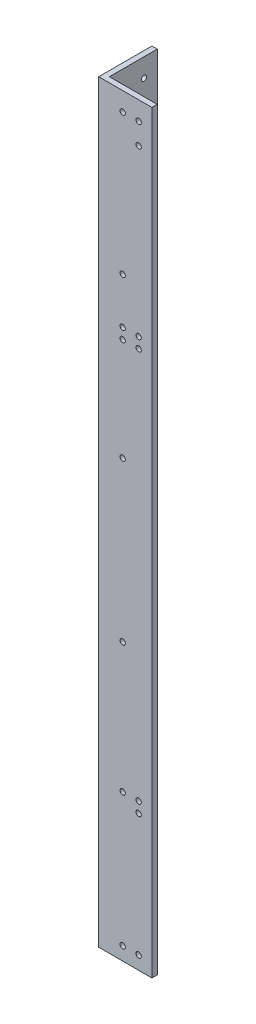
from build123d import *

# Parameters (mm, degrees)
BOSS_EXTRUDE1_DEPTH               = 450
BACKSIDEHOLES_SKETCH3_R           = 1.5875
BACKSIDEHOLES_CUT_EXTRUDE1_DEPTH  = 3.175
RIGHTSIDEHOLES_SKETCH4_R          = 1.5875
RIGHTSIDEHOLES_CUT_EXTRUDE2_DEPTH = 3.175


with BuildPart() as part:
    # Sketch2 → Boss-Extrude1 (new body)
    with BuildSketch(Plane(origin=(0, 0, 0), x_dir=(1, 0, 0), z_dir=(0, 1, 0))):
        Polygon((0, 31.75), (3.175, 31.75), (3.175, 3.175), (31.75, 3.175), (31.75, 0), (0, 0), align=None)
    extrude(amount=BOSS_EXTRUDE1_DEPTH)

    # BackSideHoles-Sketch3 → BackSideHoles-Cut-Extrude1 (cut)
    with BuildSketch(Plane.XY):
        with Locations((23.8125, 81.1125)):
            Circle(BACKSIDEHOLES_SKETCH3_R)
        with Locations((14.2875, 87.4625)):
            Circle(BACKSIDEHOLES_SKETCH3_R)
        with Locations((23.8125, 87.4625)):
            Circle(BACKSIDEHOLES_SKETCH3_R)
        with Locations((14.2875, 438.8875)):
            Circle(BACKSIDEHOLES_SKETCH3_R)
        with Locations((23.8125, 438.8875)):
            Circle(BACKSIDEHOLES_SKETCH3_R)
        with Locations((23.8125, 426.1875)):
            Circle(BACKSIDEHOLES_SKETCH3_R)
        with Locations((14.2875, 327.602644)):
            Circle(BACKSIDEHOLES_SKETCH3_R)
        with Locations((23.8125, 327.602644)):
            Circle(BACKSIDEHOLES_SKETCH3_R)
        with Locations((14.2875, 321.252644)):
            Circle(BACKSIDEHOLES_SKETCH3_R)
        with Locations((23.8125, 321.252644)):
            Circle(BACKSIDEHOLES_SKETCH3_R)
        with Locations((14.2875, 165)):
            Circle(BACKSIDEHOLES_SKETCH3_R)
        with Locations((14.2875, 260)):
            Circle(BACKSIDEHOLES_SKETCH3_R)
        with Locations((14.2875, 355)):
            Circle(BACKSIDEHOLES_SKETCH3_R)
        with Locations((14.2875, 7.9375)):
            Circle(BACKSIDEHOLES_SKETCH3_R)
        with Locations((23.8125, 7.9375)):
            Circle(BACKSIDEHOLES_SKETCH3_R)
    extrude(amount=-BACKSIDEHOLES_CUT_EXTRUDE1_DEPTH, mode=Mode.SUBTRACT)

    # RightSideHoles-Sketch4 → RightSideHoles-Cut-Extrude2 (cut)
    with BuildSketch(Plane.ZY):
        with Locations((-23.8125, 81.1125)):
            Circle(RIGHTSIDEHOLES_SKETCH4_R)
        with Locations((-23.8125, 87.4625)):
            Circle(RIGHTSIDEHOLES_SKETCH4_R)
        with Locations((-23.8125, 438.8875)):
            Circle(RIGHTSIDEHOLES_SKETCH4_R)
        with Locations((-14.2875, 426.1875)):
            Circle(RIGHTSIDEHOLES_SKETCH4_R)
        with Locations((-23.8125, 426.1875)):
            Circle(RIGHTSIDEHOLES_SKETCH4_R)
        with Locations((-23.8125, 327.602644)):
            Circle(RIGHTSIDEHOLES_SKETCH4_R)
        with Locations((-14.2875, 327.602644)):
            Circle(RIGHTSIDEHOLES_SKETCH4_R)
        with Locations((-23.8125, 314.902644)):
            Circle(RIGHTSIDEHOLES_SKETCH4_R)
        with Locations((-14.2875, 314.902644)):
            Circle(RIGHTSIDEHOLES_SKETCH4_R)
        with Locations((-23.8125, 7.9375)):
            Circle(RIGHTSIDEHOLES_SKETCH4_R)
        with Locations((-14.2875, 7.9375)):
            Circle(RIGHTSIDEHOLES_SKETCH4_R)
        with Locations((-14.2875, 165)):
            Circle(RIGHTSIDEHOLES_SKETCH4_R)
        with Locations((-14.2875, 260)):
            Circle(RIGHTSIDEHOLES_SKETCH4_R)
        with Locations((-14.2875, 355)):
            Circle(RIGHTSIDEHOLES_SKETCH4_R)
        with Locations((-14.2875, 81.1125)):
            Circle(RIGHTSIDEHOLES_SKETCH4_R)
    extrude(amount=-RIGHTSIDEHOLES_CUT_EXTRUDE2_DEPTH, mode=Mode.SUBTRACT)


solid = part.part
